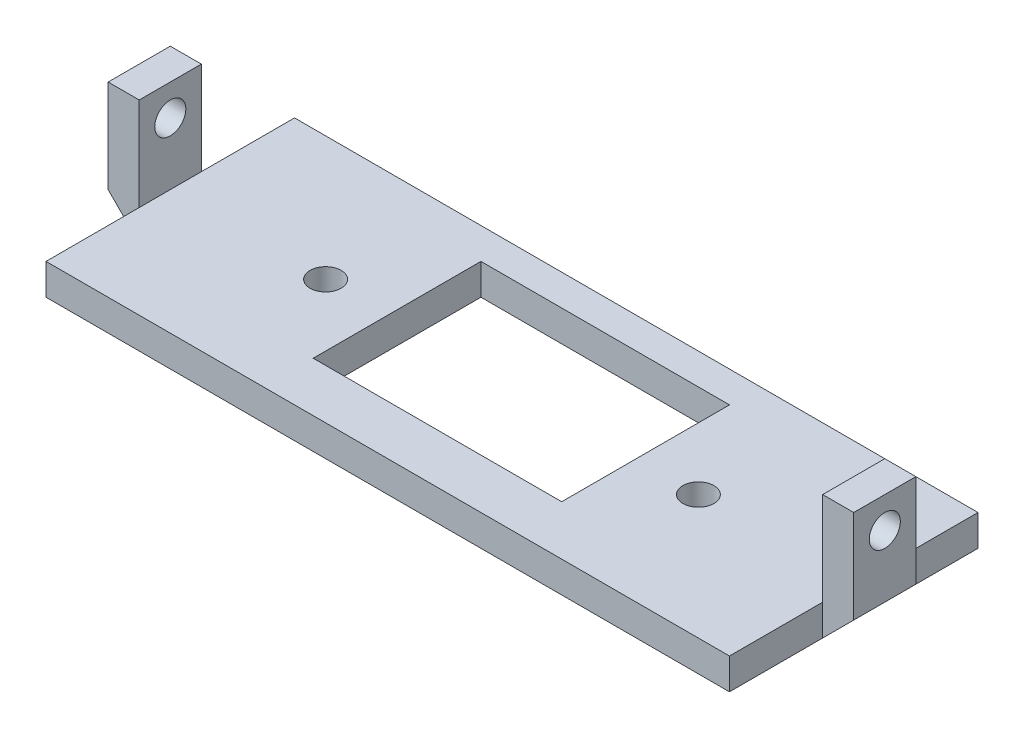
from build123d import *

# Parameters (mm, degrees)
SKETCH1_W           = 120
SKETCH1_H           = 85
BOSS_EXTRUDE1_DEPTH = 5
SKETCH2_W           = 5
SKETCH2_H           = 10
BOSS_EXTRUDE2_DEPTH = 15
SKETCH3_R           = 2.5
CUT_EXTRUDE1_DEPTH  = 129.865239689
SKETCH5_W           = 5
SKETCH5_H           = 25
SKETCH5_H_2         = 15
CUT_EXTRUDE2_DEPTH  = 76.041655099
CHAMFER1_SIZE       = 5
SKETCH6_W           = 120
SKETCH6_H           = 35
SKETCH6_W_2         = 110
SKETCH6_H_2         = 10
CUT_EXTRUDE3_DEPTH  = 77.198753271
SKETCH7_R           = 2.5
CUT_EXTRUDE4_DEPTH  = 10
SKETCH8_W           = 40
SKETCH8_H           = 27
CUT_EXTRUDE5_DEPTH  = 10


with BuildPart() as part:
    # Sketch1 → Boss-Extrude1 (new body)
    with BuildSketch(Plane(origin=(0, 0, 0), x_dir=(1, 0, 0), z_dir=(0, 1, 0))):
        Rectangle(SKETCH1_W, SKETCH1_H)
    extrude(amount=BOSS_EXTRUDE1_DEPTH)

    # Sketch2 → Boss-Extrude2 (add)
    with BuildSketch(Plane(origin=(0, 5, 0), x_dir=(1, 0, 0), z_dir=(0, 1, 0))):
        with Locations((-57.5, 12.5)):
            Rectangle(SKETCH2_W, SKETCH2_H)
        with Locations((-57.5, -12.5)):
            Rectangle(SKETCH2_W, SKETCH2_H)
        with Locations((57.5, -12.5)):
            Rectangle(SKETCH2_W, SKETCH2_H)
        with Locations((57.5, 12.5)):
            Rectangle(SKETCH2_W, SKETCH2_H)
    extrude(amount=BOSS_EXTRUDE2_DEPTH)

    # Sketch3 → Cut-Extrude1 (cut, through all)
    with BuildSketch(Plane.ZY.offset(60)):
        with Locations((-12.5, 15)):
            Circle(SKETCH3_R)
        with Locations((12.5, 15)):
            Circle(SKETCH3_R)
    extrude(amount=-CUT_EXTRUDE1_DEPTH, mode=Mode.SUBTRACT)

    # Sketch5 → Cut-Extrude2 (cut, through all)
    with BuildSketch(Plane(origin=(0, 5, 0), x_dir=(1, 0, 0), z_dir=(0, 1, 0))):
        with Locations((-57.5, 30)):
            Rectangle(SKETCH5_W, SKETCH5_H)
        with Locations((-57.5, 0)):
            Rectangle(SKETCH5_W, SKETCH5_H_2)
        with Locations((-57.5, -30)):
            Rectangle(SKETCH5_W, SKETCH5_H)
        with Locations((57.5, -30)):
            Rectangle(SKETCH5_W, SKETCH5_H)
        with Locations((57.5, 0)):
            Rectangle(SKETCH5_W, SKETCH5_H_2)
        with Locations((57.5, 30)):
            Rectangle(SKETCH5_W, SKETCH5_H)
    extrude(amount=-CUT_EXTRUDE2_DEPTH, mode=Mode.SUBTRACT)

    # Chamfer1
    chamfer1_edges = [part.edges().sort_by_distance(p)[0] for p in [
        (-60, 0, 12.5),
        (-60, 0, -12.5),
        (60, 0, -12.5),
        (60, 0, 12.5),
    ]]
    chamfer(chamfer1_edges, length=CHAMFER1_SIZE)

    # Sketch6 → Cut-Extrude3 (cut, through all)
    with BuildSketch(Plane.XZ):
        with Locations((0, -25)):
            Rectangle(SKETCH6_W, SKETCH6_H)
        with Locations((0, 37.5)):
            Rectangle(SKETCH6_W_2, SKETCH6_H_2)
    extrude(amount=-CUT_EXTRUDE3_DEPTH, mode=Mode.SUBTRACT)

    # Sketch7 → Cut-Extrude4 (cut)
    with BuildSketch(Plane.XZ):
        with Locations((-30, 12.5)):
            Circle(SKETCH7_R)
        with Locations((30, 12.5)):
            Circle(SKETCH7_R)
    extrude(amount=-CUT_EXTRUDE4_DEPTH, mode=Mode.SUBTRACT)

    # Sketch8 → Cut-Extrude5 (cut)
    with BuildSketch(Plane(origin=(0, 0, 0), x_dir=(-1, 0, 0), z_dir=(0, -1, 0))):
        with Locations((0, -11)):
            Rectangle(SKETCH8_W, SKETCH8_H)
    extrude(amount=-CUT_EXTRUDE5_DEPTH, mode=Mode.SUBTRACT)


solid = part.part
